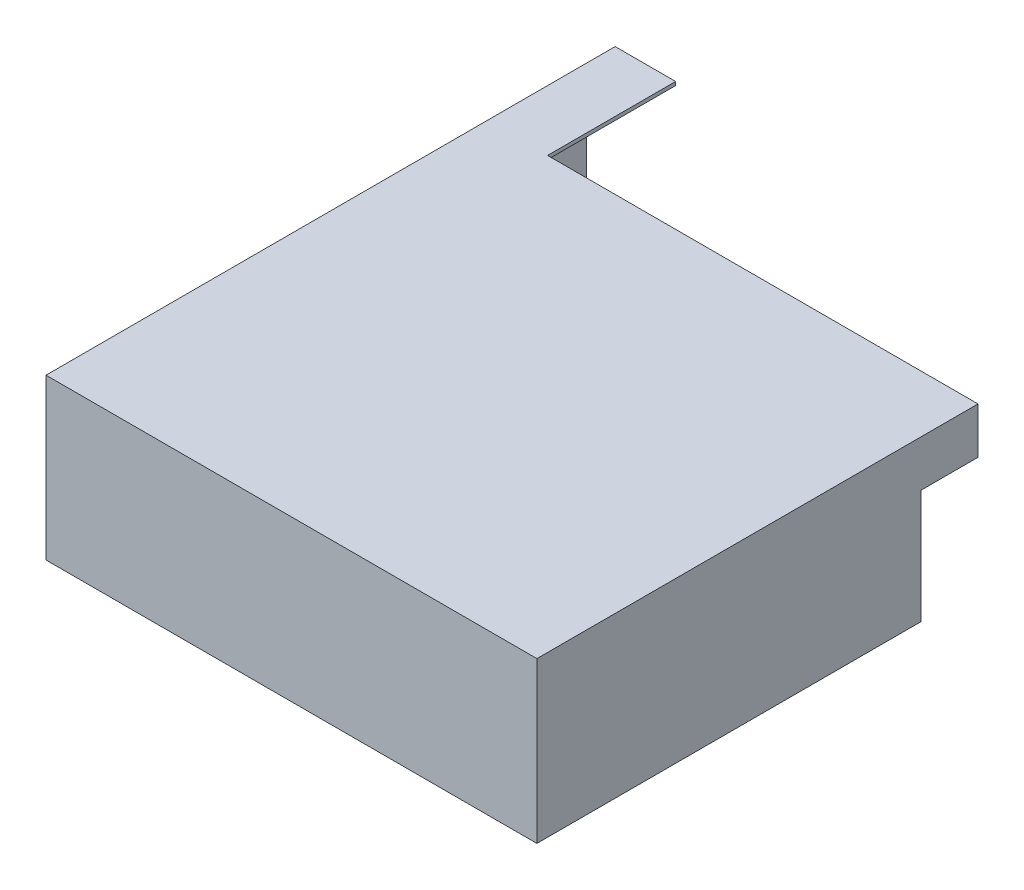
from build123d import *

# Parameters (mm, degrees)
BOSS_EXTRUDE1_DEPTH = 508
SKETCH2_W           = 438.15
SKETCH2_H           = 142.875
BOSS_EXTRUDE2_DEPTH = 3.175
SKETCH4_W           = 384.175
SKETCH4_H           = 114.3
CUT_EXTRUDE1_DEPTH  = 686.895537327
CUT_EXTRUDE2_REACH  = 687.896
SKETCH5_W           = 50.8
SKETCH5_H           = 101.6
CUT_EXTRUDE3_REACH  = 687.896
SKETCH6_W           = 28.575
SKETCH6_H           = 117.475


with BuildPart() as part:
    # Sketch1 → Boss-Extrude1 (new body)
    with BuildSketch(Plane.XY):
        Polygon((0, 0), (3.175, 0), (3.175, 139.7), (434.975, 139.7), (434.975, 0), (438.15, 0), (438.15, 142.875), (0, 142.875), align=None)
    extrude(amount=BOSS_EXTRUDE1_DEPTH)

    # Sketch2 → Boss-Extrude2 (add)
    with BuildSketch(Plane.XY.offset(508)):
        with Locations((219.075, 71.4375)):
            Rectangle(SKETCH2_W, SKETCH2_H)
    extrude(amount=-BOSS_EXTRUDE2_DEPTH)

    # Sketch4 → Cut-Extrude1 (cut, through all)
    with BuildSketch(Plane(origin=(0, 142.875, 0), x_dir=(1, 0, 0), z_dir=(0, 1, 0))):
        with Locations((246.0625, -57.15)):
            Rectangle(SKETCH4_W, SKETCH4_H)
    extrude(amount=-CUT_EXTRUDE1_DEPTH, mode=Mode.SUBTRACT)

    # Sketch5 → Cut-Extrude2 (cut, up to next)
    with BuildSketch(Plane(origin=(438.15, 0, 0), x_dir=(0, 0, -1), z_dir=(1, 0, 0)), mode=Mode.PRIVATE) as cut_extrude2_sk1:
        with Locations((-139.7, 50.8)):
            Rectangle(SKETCH5_W, SKETCH5_H)
    cut_extrude2_tool1 = extrude(cut_extrude2_sk1.sketch, amount=-CUT_EXTRUDE2_REACH, mode=Mode.PRIVATE) & part.part
    add(cut_extrude2_tool1.solids().sort_by_distance((438.15, 50.8, 139.7))[0], mode=Mode.SUBTRACT)

    # Sketch6 → Cut-Extrude3 (cut, up to next)
    with BuildSketch(Plane.ZY, mode=Mode.PRIVATE) as cut_extrude3_sk1:
        with Locations((14.2875, 58.7375)):
            Rectangle(SKETCH6_W, SKETCH6_H)
    cut_extrude3_tool1 = extrude(cut_extrude3_sk1.sketch, amount=-CUT_EXTRUDE3_REACH, mode=Mode.PRIVATE) & part.part
    add(cut_extrude3_tool1.solids().sort_by_distance((0, 58.7375, 14.2875))[0], mode=Mode.SUBTRACT)


solid = part.part
